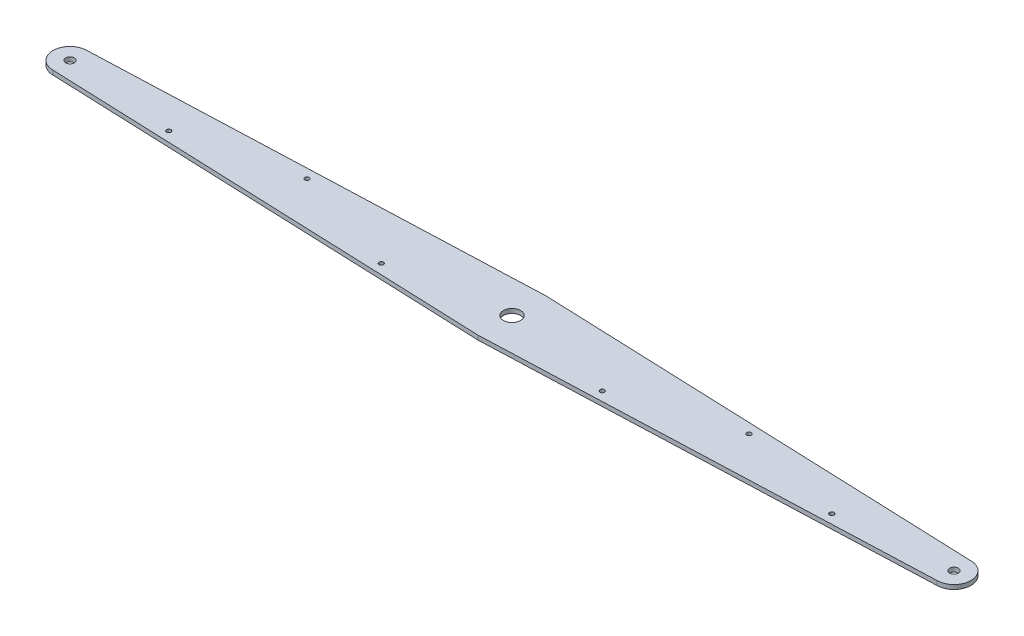
from build123d import *

# Parameters (mm, degrees)
BOSS_EXTRUDE1_DEPTH = 3.18
SKETCH3_R           = 6.35
SKETCH3_R_2         = 3.175
SKETCH3_R_3         = 1.65
CUT_EXTRUDE1_DEPTH  = 339.439599338


with BuildPart() as part:
    # Sketch2 → Boss-Extrude1 (new body)
    with BuildSketch(Plane(origin=(0, 0, 0), x_dir=(1, 0, 0), z_dir=(0, 1, 0))):
        with BuildLine():
            Line((-325, 12.5), (0, 25))
            Line((0, 25), (325, 12.5))
            ThreePointArc((325, 12.5), (337.5, 0), (325, -12.5))
            Line((325, -12.5), (0, -25))
            Line((0, -25), (-325, -12.5))
            ThreePointArc((-325, -12.5), (-337.5, 0), (-325, 12.5))
        make_face()
    extrude(amount=BOSS_EXTRUDE1_DEPTH)

    # Sketch3 → Cut-Extrude1 (cut, through all)
    with BuildSketch(Plane(origin=(0, 3.18, 0), x_dir=(1, 0, 0), z_dir=(0, 1, 0))):
        Circle(SKETCH3_R)
        with Locations((-325, 0)):
            Circle(SKETCH3_R_2)
        with Locations((-243.75, -8.625)):
            Circle(SKETCH3_R_3)
        with Locations((-162.5, 11.75)):
            Circle(SKETCH3_R_3)
        with Locations((-81.25, -14.875)):
            Circle(SKETCH3_R_3)
        with Locations((81.25, -14.875)):
            Circle(SKETCH3_R_3)
        with Locations((162.5, 11.75)):
            Circle(SKETCH3_R_3)
        with Locations((243.75, -8.625)):
            Circle(SKETCH3_R_3)
        with Locations((325, 0)):
            Circle(SKETCH3_R_2)
    extrude(amount=-CUT_EXTRUDE1_DEPTH, mode=Mode.SUBTRACT)


solid = part.part
